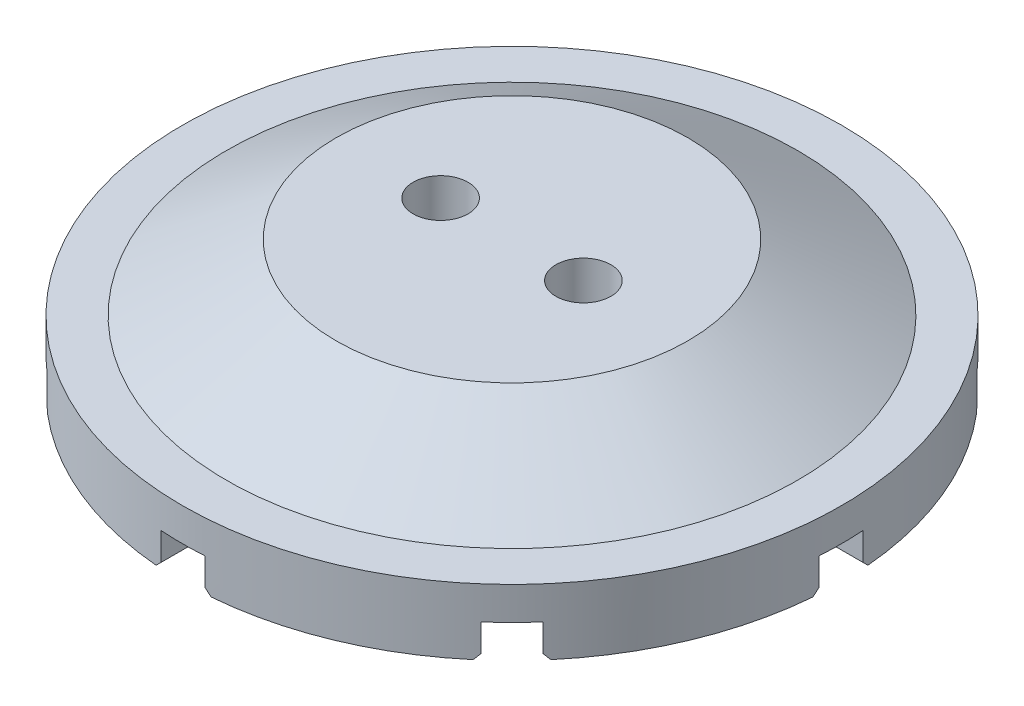
from build123d import *

# Parameters (mm, degrees)
SKETCH1_R                    = 8
BOSS_EXTRUDE1_DEPTH          = 3
SKETCH2_R                    = 1.25
CUT_EXTRUDE1_DEPTH           = 12.704699911
SKETCH3_R                    = 15
BOSS_EXTRUDE2_DEPTH          = 3
CHAMFER1_SIZE                = 5
CHAMFER1_SIZE_2              = 3.004303095
SKETCH4_W                    = 15
SKETCH4_H                    = 2
CUT_EXTRUDE2_DEPTH           = 1.5
CHAMFER2_SIZE                = 0.25
CIRPATTERN1_COUNT            = 8
CHAMFER2_OF_CIRPATTERN1_SIZE = 0.25
FILLET1_R                    = 0.5


with BuildPart() as part:
    # Sketch1 → Boss-Extrude1 (new body)
    with BuildSketch(Plane(origin=(0, 0, 0), x_dir=(1, 0, 0), z_dir=(0, 1, 0))):
        with Locations(Location((0, 0, 0), (0, 0, 270))):
            Circle(SKETCH1_R)
    extrude(amount=BOSS_EXTRUDE1_DEPTH)

    # Sketch2 → Cut-Extrude1 (cut, through all)
    with BuildSketch(Plane(origin=(0, 3, 0), x_dir=(1, 0, 0), z_dir=(0, 1, 0))):
        with Locations(Location((-3.25, 0, 0), (0, 0, 270))):
            Circle(SKETCH2_R)
        with Locations(Location((3.25, 0, 0), (0, 0, 270))):
            Circle(SKETCH2_R)
    extrude(amount=-CUT_EXTRUDE1_DEPTH, mode=Mode.SUBTRACT)

    # Sketch3 → Boss-Extrude2 (add)
    with BuildSketch(Plane.XZ):
        with Locations(Location((0, 0, 0), (0, 0, 270))):
            Circle(SKETCH3_R)
    extrude(amount=BOSS_EXTRUDE2_DEPTH)

    # Chamfer1
    # the kernel refuses this chamfer: 5, 3.004303095 mm, written as the material it adds along each edge
    with BuildSketch(Plane(origin=(0, 0, 0), x_dir=(0, 0, 1), z_dir=(-1, 0, 0))) as chamfer1_piece_1_section:
        Polygon((8 + CHAMFER1_SIZE, 0), (8, CHAMFER1_SIZE_2), (8, 0), align=None)
    chamfer1_piece_1 = revolve(axis=Axis((0, 0, 0), (0, 1, 0)), mode=Mode.PRIVATE)
    chamfer1_piece_1 = split(chamfer1_piece_1, bisect_by=Plane(origin=(0, 3, -10.54798904), z_dir=(0, -1, 0)), keep=Keep.TOP, mode=Mode.PRIVATE)
    add(chamfer1_piece_1)

    # Sketch4 → Cut-Extrude2 (cut)
    with BuildSketch(Plane.XZ.offset(3)):
        with Locations((7.5, 0)):
            Rectangle(SKETCH4_W, SKETCH4_H)
    cut_extrude2 = extrude(amount=-CUT_EXTRUDE2_DEPTH, mode=Mode.SUBTRACT)

    # Chamfer2
    chamfer2_edges = [part.edges().sort_by_distance(p)[0] for p in [
        (7.483314774, -3, 1),
        (7.483314774, -3, -1),
    ]]
    chamfer(chamfer2_edges, length=CHAMFER2_SIZE)

    # CirPattern1: Cut-Extrude2 ×8 about axis
    cirpattern1_axis = Axis((0, 0, 0), (0, 1, 0))
    for i in range(1, CIRPATTERN1_COUNT):
        add(cut_extrude2.rotate(cirpattern1_axis, i * 360 / CIRPATTERN1_COUNT), mode=Mode.SUBTRACT)

    # Chamfer2 of CirPattern1
    chamfer2_of_cirpattern1_edges = [part.edges().sort_by_distance(p)[0] for p in [
        (5.998609403, -3, -4.584395841),
        (4.584395841, -3, -5.998609403),
        (1, -3, -7.483314774),
        (-1, -3, -7.483314774),
        (-4.584395841, -3, -5.998609403),
        (-5.998609403, -3, -4.584395841),
        (-7.483314774, -3, -1),
        (-7.483314774, -3, 1),
        (-5.998609403, -3, 4.584395841),
        (-4.584395841, -3, 5.998609403),
        (-1, -3, 7.483314774),
        (1, -3, 7.483314774),
        (4.584395841, -3, 5.998609403),
        (5.998609403, -3, 4.584395841),
    ]]
    chamfer(chamfer2_of_cirpattern1_edges, length=CHAMFER2_OF_CIRPATTERN1_SIZE)

    # Fillet1
    # the kernel refuses this fillet: 0.5 mm, written as the material it takes off along each edge
    with BuildSketch(Plane(origin=(1, -1.5, -2.414213562), x_dir=(0, 0, -1), z_dir=(0, -1, 0)), Plane(origin=(-1, -1.5, 2.414213562), x_dir=(0, 0, 1), z_dir=(0, -1, 0)), Plane(origin=(1, -1.5, 2.414213562), x_dir=(0.7071067811865474, 0, 0.7071067811865477), z_dir=(0, -1, 0)), Plane(origin=(2.414213562, -1.5, -1), x_dir=(0.7071067811865472, 0, -0.7071067811865478), z_dir=(0, -1, 0))) as fillet1_piece_1:
        with BuildLine():
            CenterArc((FILLET1_R * 2.41421356237, FILLET1_R), FILLET1_R, 135, 135)
            Line((FILLET1_R * 1.70710678119, FILLET1_R * 1.70710678119), (0, 0))
            Line((0, 0), (FILLET1_R * 2.41421356237, 0))
        make_face()
    extrude(amount=4.267766953, mode=Mode.SUBTRACT)
    with BuildSketch(Plane(origin=(-1, -1.5, -2.414213562), x_dir=(0, 0, -1), z_dir=(0, -1, 0)), Plane(origin=(-2.414213562, -1.5, -1), x_dir=(-0.7071067811865478, 0, -0.7071067811865474), z_dir=(0, -1, 0)), Plane(origin=(-2.414213562, -1.5, 1), x_dir=(-1, 0, 0), z_dir=(0, -1, 0)), Plane(origin=(2.414213562, -5.767766953, 1), x_dir=(1, 0, 0), z_dir=(0, 1, 0))) as fillet1_piece_2:
        with BuildLine():
            CenterArc((FILLET1_R * 2.41421356237, -FILLET1_R), FILLET1_R, 90, 135)
            Line((FILLET1_R * 1.70710678119, -FILLET1_R * 1.70710678119), (0, 0))
            Line((0, 0), (FILLET1_R * 2.41421356237, 0))
        make_face()
    extrude(amount=4.267766953, mode=Mode.SUBTRACT)


solid = part.part
